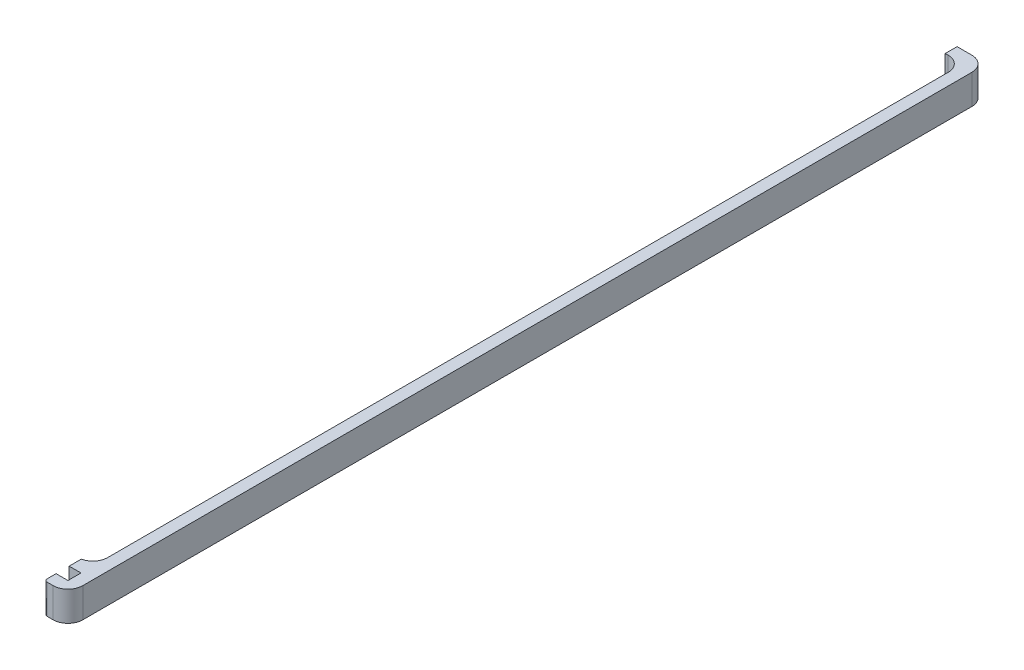
from build123d import *

# Parameters (mm, degrees)
SKETCH1_W                       = 39
SKETCH1_H                       = 155
BOSS_EXTRUDE1_DEPTH             = 2
BOSS_EXTRUDE2_DEPTH             = 38
SKETCH3_W                       = 2
SKETCH3_H                       = 2
BOSS_EXTRUDE3_DEPTH             = 38
SKETCH4_W                       = 2
SKETCH4_H                       = 2
BOSS_EXTRUDE4_DEPTH             = 151
SKETCH6_W                       = 35
SKETCH6_H                       = 2.2
CUT_EXTRUDE1_DEPTH              = 160.340045186
SKETCH7_W                       = 35
SKETCH7_H                       = 2.2
CUT_EXTRUDE2_DEPTH              = 89.490112442
SKETCH5_W                       = 31
SKETCH5_H                       = 2
BOSS_EXTRUDE5_DEPTH             = 2
BOSS_EXTRUDE6_REACH             = 91.367
SKETCH8_W                       = 2
SKETCH8_H                       = 2
BOSS_EXTRUDE6_DIRECTION_2_REACH = 91.367
SKETCH10_W                      = 2
SKETCH10_H                      = 2.2
SKETCH10_W_2                    = 2.2
SKETCH10_H_2                    = 2
BOSS_EXTRUDE8_DEPTH             = 2
SKETCH11_W                      = 2
SKETCH11_H                      = 2.2
SKETCH11_W_2                    = 2.2
SKETCH11_H_2                    = 2
BOSS_EXTRUDE9_DEPTH             = 2
FILLET2_R                       = 2.5
SKETCH14_W                      = 36.5
SKETCH14_H                      = 7.75
BOSS_EXTRUDE10_DEPTH            = 2
SKETCH13_W                      = 31
SKETCH13_H                      = 3
CUT_EXTRUDE4_DEPTH              = 2
FILLET3_R                       = 2
FILLET4_R                       = 0.5
SKETCH15_R                      = 5.1
CUT_EXTRUDE5_DEPTH              = 90.367219941
SKETCH16_R                      = 7.1
BOSS_EXTRUDE11_DEPTH            = 1
FILLET5_R                       = 0.5
CUT_EXTRUDE3_DEPTH              = 160.340045186
FILLET6_R                       = 0.4
FILLET7_R                       = 0.5
CUT_EXTRUDE6_DEPTH              = 6
SKETCH18_W                      = 29
SKETCH18_H                      = 3
CUT_EXTRUDE8_DEPTH              = 90.367220028
CUT_EXTRUDE11_DEPTH             = 90.367220028
CUT_EXTRUDE11_DEPTH_BACK        = 90.367220028
SKETCH20_W                      = 29
SKETCH20_H                      = 34
SKETCH21_W                      = 155
SKETCH21_H                      = 10
CUT_EXTRUDE12_DEPTH             = 90.367219941
SKETCH22_W                      = 155
SKETCH22_H                      = 15
CUT_EXTRUDE13_DEPTH             = 84.254129027


with BuildPart() as part:
    # Sketch1 → Boss-Extrude1 (new body)
    with BuildSketch(Plane(origin=(0, 0, 0), x_dir=(1, 0, 0), z_dir=(0, 1, 0))):
        Rectangle(SKETCH1_W, SKETCH1_H)
    extrude(amount=BOSS_EXTRUDE1_DEPTH)

    # Sketch2 → Boss-Extrude2 (add)
    with BuildSketch(Plane(origin=(0, 2, 0), x_dir=(1, 0, 0), z_dir=(0, 1, 0))):
        Polygon((-17.5, -77.5), (-17.5, -75.5), (-17.5, 75.5), (17.5, 75.5), (17.5, -75.5), (17.5, -77.5), (19.5, -77.5), (19.5, 77.5), (-19.5, 77.5), (-19.5, -77.5), align=None)
    extrude(amount=BOSS_EXTRUDE2_DEPTH)

    # Sketch3 → Boss-Extrude3 (add)
    with BuildSketch(Plane(origin=(0, 2, 0), x_dir=(1, 0, 0), z_dir=(0, 1, 0))):
        with Locations((-16.5, -76.5)):
            Rectangle(SKETCH3_W, SKETCH3_H)
        with Locations((-16.5, -72.3)):
            Rectangle(SKETCH3_W, SKETCH3_H)
        with Locations((16.5, -76.5)):
            Rectangle(SKETCH3_W, SKETCH3_H)
        with Locations((16.5, -72.3)):
            Rectangle(SKETCH3_W, SKETCH3_H)
    extrude(amount=BOSS_EXTRUDE3_DEPTH)

    # Sketch4 → Boss-Extrude4 (add)
    with BuildSketch(Plane.XY.offset(-75.5)):
        with Locations((-16.5, 39)):
            Rectangle(SKETCH4_W, SKETCH4_H)
        Polygon((-15.5, 33.8), (-17.5, 31.8), (-17.5, 35.8), (-15.5, 35.8), align=None)
        Polygon((15.5, 35.8), (17.5, 35.8), (17.5, 31.8), (15.5, 33.8), align=None)
        with Locations((16.5, 39)):
            Rectangle(SKETCH4_W, SKETCH4_H)
    extrude(amount=BOSS_EXTRUDE4_DEPTH)

    # Sketch6 → Cut-Extrude1 (cut, through all)
    with BuildSketch(Plane.XY.offset(-75.5)):
        with Locations((0, 36.9)):
            Rectangle(SKETCH6_W, SKETCH6_H)
    extrude(amount=CUT_EXTRUDE1_DEPTH, mode=Mode.SUBTRACT)

    # Sketch7 → Cut-Extrude2 (cut, through all)
    with BuildSketch(Plane(origin=(0, 2, 0), x_dir=(1, 0, 0), z_dir=(0, 1, 0))):
        with Locations((0, -74.4)):
            Rectangle(SKETCH7_W, SKETCH7_H)
    extrude(amount=CUT_EXTRUDE2_DEPTH, mode=Mode.SUBTRACT)

    # Sketch5 → Boss-Extrude5 (add)
    with BuildSketch(Plane(origin=(0, 2, 0), x_dir=(1, 0, 0), z_dir=(0, 1, 0))):
        with Locations((0, -76.5)):
            Rectangle(SKETCH5_W, SKETCH5_H)
        with Locations((0, -72.3)):
            Rectangle(SKETCH5_W, SKETCH5_H)
    extrude(amount=BOSS_EXTRUDE5_DEPTH)

    # Boss-Extrude6: up to this face of the body (flat: up to its plane)
    boss_extrude6_end = Plane(part.part.faces().sort_by_distance((17.5, 16.9, -2.1))[0])
    # Sketch8 → Boss-Extrude6 (add, up to the picked face)
    with BuildSketch(Plane(origin=(0, 0, 0), x_dir=(0, 0, -1), z_dir=(1, 0, 0)), mode=Mode.PRIVATE) as boss_extrude6_sk1:
        with Locations((74.5, 39)):
            Rectangle(SKETCH8_W, SKETCH8_H)
    boss_extrude6_tool1 = split(extrude(boss_extrude6_sk1.sketch, amount=BOSS_EXTRUDE6_REACH, mode=Mode.PRIVATE), bisect_by=boss_extrude6_end, keep=Keep.BOTH, mode=Mode.PRIVATE)
    # Sketch8 → Boss-Extrude6 (add, up to the picked face)
    with BuildSketch(Plane(origin=(0, 0, 0), x_dir=(0, 0, -1), z_dir=(1, 0, 0)), mode=Mode.PRIVATE) as boss_extrude6_sk2:
        Polygon((75.5, 35.8), (73.5, 35.8), (73.5, 33.8), (75.5, 31.8), align=None)
    boss_extrude6_tool2 = split(extrude(boss_extrude6_sk2.sketch, amount=BOSS_EXTRUDE6_REACH, mode=Mode.PRIVATE), bisect_by=boss_extrude6_end, keep=Keep.BOTH, mode=Mode.PRIVATE)
    add(boss_extrude6_tool1.solids().sort_by(Axis((0, 39, -74.5), (1, 0, 0)))[0])
    add(boss_extrude6_tool2.solids().sort_by(Axis((0, 34.244444, -74.611111), (1, 0, 0)))[0])

    # Boss-Extrude6 direction 2: up to this face of the body (flat: up to its plane)
    boss_extrude6_direction_2_end = Plane(part.part.faces().sort_by_distance((-17.5, 16.9, -2.1))[0])
    # Sketch8 → Boss-Extrude6 direction 2 (add, up to the picked face)
    with BuildSketch(Plane(origin=(0, 0, 0), x_dir=(0, 0, -1), z_dir=(1, 0, 0)), mode=Mode.PRIVATE) as boss_extrude6_direction_2_sk1:
        with Locations((74.5, 39)):
            Rectangle(SKETCH8_W, SKETCH8_H)
    boss_extrude6_direction_2_tool1 = split(extrude(boss_extrude6_direction_2_sk1.sketch, amount=-BOSS_EXTRUDE6_DIRECTION_2_REACH, mode=Mode.PRIVATE), bisect_by=boss_extrude6_direction_2_end, keep=Keep.BOTH, mode=Mode.PRIVATE)
    # Sketch8 → Boss-Extrude6 direction 2 (add, up to the picked face)
    with BuildSketch(Plane(origin=(0, 0, 0), x_dir=(0, 0, -1), z_dir=(1, 0, 0)), mode=Mode.PRIVATE) as boss_extrude6_direction_2_sk2:
        Polygon((75.5, 35.8), (73.5, 35.8), (73.5, 33.8), (75.5, 31.8), align=None)
    boss_extrude6_direction_2_tool2 = split(extrude(boss_extrude6_direction_2_sk2.sketch, amount=-BOSS_EXTRUDE6_DIRECTION_2_REACH, mode=Mode.PRIVATE), bisect_by=boss_extrude6_direction_2_end, keep=Keep.BOTH, mode=Mode.PRIVATE)
    add(boss_extrude6_direction_2_tool1.solids().sort_by(Axis((0, 39, -74.5), (-1, 0, 0)))[0])
    add(boss_extrude6_direction_2_tool2.solids().sort_by(Axis((0, 34.244444, -74.611111), (-1, 0, 0)))[0])

    # Sketch10 → Boss-Extrude8 (add)
    with BuildSketch(Plane(origin=(-17.5, 0, 0), x_dir=(0, 0, -1), z_dir=(1, 0, 0))):
        with Locations((-76.5, 36.9)):
            Rectangle(SKETCH10_W, SKETCH10_H)
        with Locations((-74.4, 39)):
            Rectangle(SKETCH10_W_2, SKETCH10_H_2)
    extrude(amount=BOSS_EXTRUDE8_DEPTH)

    # Sketch11 → Boss-Extrude9 (add)
    with BuildSketch(Plane.ZY.offset(-17.5)):
        with Locations((76.5, 36.9)):
            Rectangle(SKETCH11_W, SKETCH11_H)
        with Locations((74.4, 39)):
            Rectangle(SKETCH11_W_2, SKETCH11_H_2)
    extrude(amount=BOSS_EXTRUDE9_DEPTH)

    # Fillet2
    fillet2_edges = [part.edges().sort_by_distance(p)[0] for p in [
        (-17.5, 16.9, 71.3),
        (17.5, 16.9, 71.3),
        (19.5, 20, 77.5),
        (-19.5, 20, 77.5),
        (-19.5, 20, -77.5),
        (-17.5, 16.9, -75.5),
        (17.5, 16.9, -75.5),
        (19.5, 20, -77.5),
        (19.5, 40, 0),
        (-19.5, 40, 0),
        (19.5, 0, 0),
        (-19.5, 0, 0),
        (0, 40, -77.5),
        (0, 0, 77.5),
        (0, 0, -77.5),
        (-17.5, 40, 77.5),
        (17.5, 40, 77.5),
    ]]
    fillet(fillet2_edges, radius=FILLET2_R)

    # Sketch14 → Boss-Extrude10 (add)
    with BuildSketch(Plane.XY.offset(-75.5)):
        with Locations((0, 5.125)):
            Rectangle(SKETCH14_W, SKETCH14_H)
    extrude(amount=BOSS_EXTRUDE10_DEPTH)

    # Sketch13 → Cut-Extrude4 (cut)
    with BuildSketch(Plane(origin=(0, 0, -77.5), x_dir=(-1, 0, 0), z_dir=(0, 0, -1))):
        with Locations((0, 5.5)):
            Rectangle(SKETCH13_W, SKETCH13_H)
    extrude(amount=-CUT_EXTRUDE4_DEPTH, mode=Mode.SUBTRACT)

    # Fillet3
    fillet3_edges = [part.edges().sort_by_distance(p)[0] for p in [
        (0, 9, -73.5),
    ]]
    fillet(fillet3_edges, radius=FILLET3_R - 0.0001)  # a hair under: the kernel refuses the full size

    # Fillet4
    fillet4_edges = [part.edges().sort_by_distance(p)[0] for p in [
        (15.5, 5.5, -75.5),
        (15.5, 4, -76.5),
        (0, 7, -75.5),
        (15.5, 7, -76.5),
        (-15.5, 5.5, -75.5),
        (-15.5, 7, -76.5),
        (0, 4, -75.5),
        (-15.5, 4, -76.5),
        (15.5, 5.5, -77.5),
        (0, 4, -77.5),
        (-15.5, 5.5, -77.5),
        (0, 7, -77.5),
    ]]
    fillet(fillet4_edges, radius=FILLET4_R)

    # Sketch15 → Cut-Extrude5 (cut, through all)
    with BuildSketch(Plane.XZ):
        with Locations(Location((0, 38.75, 0), (0, 0, 270))):
            Circle(SKETCH15_R)
        with Locations(Location((0, -38.75, 0), (0, 0, 270))):
            Circle(SKETCH15_R)
    extrude(amount=-CUT_EXTRUDE5_DEPTH, mode=Mode.SUBTRACT)

    # Sketch16 → Boss-Extrude11 (add)
    with BuildSketch(Plane(origin=(0, 2, 0), x_dir=(1, 0, 0), z_dir=(0, 1, 0))):
        with Locations(Location((0, 38.75, 0), (0, 0, 270))):
            Circle(SKETCH16_R)
        with Locations(Location((0, -38.75, 0), (0, 0, 270))):
            Circle(SKETCH16_R)
    extrude(amount=BOSS_EXTRUDE11_DEPTH)

    # Fillet5
    fillet5_edges = [part.edges().sort_by_distance(p)[0] for p in [
        (0, 2, -45.85),
        (0, 3, -45.85),
        (0, 2, 31.65),
        (0, 3, 31.65),
    ]]
    fillet(fillet5_edges, radius=FILLET5_R - 0.0001)  # a hair under: the kernel refuses the full size

    # Sketch12 → Cut-Extrude3 (cut, through all)
    with BuildSketch(Plane.XY.offset(-75.5)):
        with BuildLine():
            Line((1.668907005, 12.688040659), (2.22520934, 10.250720878))
            ThreePointArc((2.22520934, 10.250720878), (4.338837391, 10.990311321), (6.234898019, 12.181685175))
            Line((6.234898019, 12.181685175), (4.676173514, 14.136263881))
            ThreePointArc((4.676173514, 14.136263881), (3.254128043, 13.242733491), (1.668907005, 12.688040659))
        make_face()
        with BuildLine():
            ThreePointArc((-6.234898019, 12.181685175), (-4.338837391, 10.990311321), (-2.22520934, 10.250720878))
            Line((-2.22520934, 10.250720878), (-1.668907005, 12.688040659))
            ThreePointArc((-1.668907005, 12.688040659), (-3.254128043, 13.242733491), (-4.676173514, 14.136263881))
            Line((-4.676173514, 14.136263881), (-6.234898019, 12.181685175))
        make_face()
        with BuildLine():
            ThreePointArc((-10, 20), (-9.749279122, 17.77479066), (-9.009688679, 15.661162609))
            Line((-9.009688679, 15.661162609), (-6.757266509, 16.745871957))
            ThreePointArc((-6.757266509, 16.745871957), (-7.311959341, 18.331092995), (-7.5, 20))
            Line((-7.5, 20), (-10, 20))
        make_face()
        with BuildLine():
            ThreePointArc((-6.234898019, 27.818314825), (-7.818314825, 26.234898019), (-9.009688679, 24.338837391))
            Line((-9.009688679, 24.338837391), (-6.757266509, 23.254128043))
            ThreePointArc((-6.757266509, 23.254128043), (-5.863736119, 24.676173514), (-4.676173514, 25.863736119))
            Line((-4.676173514, 25.863736119), (-6.234898019, 27.818314825))
        make_face()
        with BuildLine():
            ThreePointArc((-1.668907005, 27.311959341), (-0.839733571, 27.452841574), (0, 27.5))
            Line((0, 27.5), (0, 30))
            ThreePointArc((0, 30), (-1.119644761, 29.937122099), (-2.22520934, 29.749279122))
            Line((-2.22520934, 29.749279122), (-1.668907005, 27.311959341))
        make_face()
        with BuildLine():
            Line((0, 30), (0, 27.5))
            ThreePointArc((0, 27.5), (0.839733571, 27.452841574), (1.668907005, 27.311959341))
            Line((1.668907005, 27.311959341), (2.22520934, 29.749279122))
            ThreePointArc((2.22520934, 29.749279122), (1.119644761, 29.937122099), (0, 30))
        make_face()
        with BuildLine():
            Line((6.757266509, 23.254128043), (9.009688679, 24.338837391))
            ThreePointArc((9.009688679, 24.338837391), (7.818314825, 26.234898019), (6.234898019, 27.818314825))
            Line((6.234898019, 27.818314825), (4.676173514, 25.863736119))
            ThreePointArc((4.676173514, 25.863736119), (5.863736119, 24.676173514), (6.757266509, 23.254128043))
        make_face()
        with BuildLine():
            Line((6.757266509, 16.745871957), (9.009688679, 15.661162609))
            ThreePointArc((9.009688679, 15.661162609), (9.749279122, 17.77479066), (10, 20))
            Line((10, 20), (7.5, 20))
            ThreePointArc((7.5, 20), (7.311959341, 18.331092995), (6.757266509, 16.745871957))
        make_face()
        with BuildLine():
            ThreePointArc((2.5, 20), (2.43731978, 19.443697665), (2.25242217, 18.915290652))
            Line((2.25242217, 18.915290652), (4.50484434, 17.830581304))
            ThreePointArc((4.50484434, 17.830581304), (4.874639561, 18.88739533), (5, 20))
            Line((5, 20), (2.5, 20))
        make_face()
        with BuildLine():
            ThreePointArc((1.558724505, 21.954578706), (1.954578706, 21.558724505), (2.25242217, 21.084709348))
            Line((2.25242217, 21.084709348), (4.50484434, 22.169418696))
            ThreePointArc((4.50484434, 22.169418696), (3.909157412, 23.117449009), (3.117449009, 23.909157412))
            Line((3.117449009, 23.909157412), (1.558724505, 21.954578706))
        make_face()
        with BuildLine():
            Line((0, 25), (0, 22.5))
            ThreePointArc((0, 22.5), (0.27991119, 22.484280525), (0.556302335, 22.43731978))
            Line((0.556302335, 22.43731978), (1.11260467, 24.874639561))
            ThreePointArc((1.11260467, 24.874639561), (0.559822381, 24.968561049), (0, 25))
        make_face()
        with BuildLine():
            ThreePointArc((-0.556302335, 22.43731978), (-0.27991119, 22.484280525), (0, 22.5))
            Line((0, 22.5), (0, 25))
            ThreePointArc((0, 25), (-0.559822381, 24.968561049), (-1.11260467, 24.874639561))
            Line((-1.11260467, 24.874639561), (-0.556302335, 22.43731978))
        make_face()
        with BuildLine():
            ThreePointArc((-2.25242217, 21.084709348), (-1.954578706, 21.558724505), (-1.558724505, 21.954578706))
            Line((-1.558724505, 21.954578706), (-3.117449009, 23.909157412))
            ThreePointArc((-3.117449009, 23.909157412), (-3.909157412, 23.117449009), (-4.50484434, 22.169418696))
            Line((-4.50484434, 22.169418696), (-2.25242217, 21.084709348))
        make_face()
        with BuildLine():
            ThreePointArc((-2.25242217, 18.915290652), (-2.43731978, 19.443697665), (-2.5, 20))
            Line((-2.5, 20), (-5, 20))
            ThreePointArc((-5, 20), (-4.874639561, 18.88739533), (-4.50484434, 17.830581304))
            Line((-4.50484434, 17.830581304), (-2.25242217, 18.915290652))
        make_face()
        with BuildLine():
            ThreePointArc((-3.117449009, 16.090842588), (-2.169418696, 15.49515566), (-1.11260467, 15.125360439))
            Line((-1.11260467, 15.125360439), (-0.556302335, 17.56268022))
            ThreePointArc((-0.556302335, 17.56268022), (-1.084709348, 17.74757783), (-1.558724505, 18.045421294))
            Line((-1.558724505, 18.045421294), (-3.117449009, 16.090842588))
        make_face()
        with BuildLine():
            Line((0.556302335, 17.56268022), (1.11260467, 15.125360439))
            ThreePointArc((1.11260467, 15.125360439), (2.169418696, 15.49515566), (3.117449009, 16.090842588))
            Line((3.117449009, 16.090842588), (1.558724505, 18.045421294))
            ThreePointArc((1.558724505, 18.045421294), (1.084709348, 17.74757783), (0.556302335, 17.56268022))
        make_face()
    extrude(amount=-CUT_EXTRUDE3_DEPTH, mode=Mode.SUBTRACT)

    # Fillet6
    fillet6_edges = [part.edges().sort_by_distance(p)[0] for p in [
        (5.863736119, 24.676173514, -75.5),
        (5.455535766, 26.841025472, -75.5),
        (7.818314825, 26.234898019, -77.5),
        (7.883477594, 23.796482717, -77.5),
        (5.863736119, 24.676173514, -77.5),
        (5.455535766, 26.841025472, -77.5),
        (7.883477594, 23.796482717, -75.5),
        (7.818314825, 26.234898019, -75.5),
        (7.311959341, 18.331092995, -75.5),
        (8.75, 20, -75.5),
        (9.749279122, 17.77479066, -77.5),
        (7.883477594, 16.203517283, -77.5),
        (7.311959341, 18.331092995, -77.5),
        (8.75, 20, -77.5),
        (7.883477594, 16.203517283, -75.5),
        (9.749279122, 17.77479066, -75.5),
        (2.43731978, 19.443697665, -75.5),
        (3.75, 20, -75.5),
        (4.874639561, 18.88739533, -77.5),
        (3.378633255, 18.372935978, -77.5),
        (2.43731978, 19.443697665, -77.5),
        (3.75, 20, -77.5),
        (3.378633255, 18.372935978, -75.5),
        (4.874639561, 18.88739533, -75.5),
        (1.954578706, 21.558724505, -75.5),
        (2.338086757, 22.931868059, -75.5),
        (3.909157412, 23.117449009, -77.5),
        (3.378633255, 21.627064022, -77.5),
        (1.954578706, 21.558724505, -77.5),
        (2.338086757, 22.931868059, -77.5),
        (3.378633255, 21.627064022, -75.5),
        (3.909157412, 23.117449009, -75.5),
        (0, 27.5, -75.5),
        (-1.947058172, 28.530619232, -75.5),
        (0, 30, -77.5),
        (1.947058172, 28.530619232, -77.5),
        (0, 27.5, -77.5),
        (-1.947058172, 28.530619232, -77.5),
        (1.947058172, 28.530619232, -75.5),
        (0, 30, -75.5),
        (-5.863736119, 24.676173514, -75.5),
        (-7.883477594, 23.796482717, -75.5),
        (-7.818314825, 26.234898019, -77.5),
        (-5.455535766, 26.841025472, -77.5),
        (-5.863736119, 24.676173514, -77.5),
        (-7.883477594, 23.796482717, -77.5),
        (-5.455535766, 26.841025472, -75.5),
        (-7.818314825, 26.234898019, -75.5),
        (-7.311959341, 18.331092995, -75.5),
        (-7.883477594, 16.203517283, -75.5),
        (-9.749279122, 17.77479066, -77.5),
        (-8.75, 20, -77.5),
        (-7.311959341, 18.331092995, -77.5),
        (-7.883477594, 16.203517283, -77.5),
        (-8.75, 20, -75.5),
        (-9.749279122, 17.77479066, -75.5),
        (-3.254128043, 13.242733491, -75.5),
        (-1.947058172, 11.469380768, -75.5),
        (-4.338837391, 10.990311321, -77.5),
        (-5.455535766, 13.158974528, -77.5),
        (-3.254128043, 13.242733491, -77.5),
        (-1.947058172, 11.469380768, -77.5),
        (-5.455535766, 13.158974528, -75.5),
        (-4.338837391, 10.990311321, -75.5),
        (1.084709348, 17.74757783, -75.5),
        (2.338086757, 17.068131941, -75.5),
        (2.169418696, 15.49515566, -77.5),
        (0.834453502, 16.344020329, -77.5),
        (1.084709348, 17.74757783, -77.5),
        (2.338086757, 17.068131941, -77.5),
        (0.834453502, 16.344020329, -75.5),
        (2.169418696, 15.49515566, -75.5),
        (-2.43731978, 19.443697665, -75.5),
        (-3.378633255, 18.372935978, -75.5),
        (-4.874639561, 18.88739533, -77.5),
        (-3.75, 20, -77.5),
        (-2.43731978, 19.443697665, -77.5),
        (-3.378633255, 18.372935978, -77.5),
        (-3.75, 20, -75.5),
        (-4.874639561, 18.88739533, -75.5),
        (-1.084709348, 17.74757783, -75.5),
        (-0.834453502, 16.344020329, -75.5),
        (-2.169418696, 15.49515566, -77.5),
        (-2.338086757, 17.068131941, -77.5),
        (-1.084709348, 17.74757783, -77.5),
        (-0.834453502, 16.344020329, -77.5),
        (-2.338086757, 17.068131941, -75.5),
        (-2.169418696, 15.49515566, -75.5),
        (-1.954578706, 21.558724505, -75.5),
        (-3.378633255, 21.627064022, -75.5),
        (-3.909157412, 23.117449009, -77.5),
        (-2.338086757, 22.931868059, -77.5),
        (-1.954578706, 21.558724505, -77.5),
        (-3.378633255, 21.627064022, -77.5),
        (-2.338086757, 22.931868059, -75.5),
        (-3.909157412, 23.117449009, -75.5),
        (0, 25, -77.5),
        (0.834453502, 23.655979671, -77.5),
        (0, 22.5, -75.5),
        (-0.834453502, 23.655979671, -75.5),
        (0, 22.5, -77.5),
        (-0.834453502, 23.655979671, -77.5),
        (0, 25, -75.5),
        (0.834453502, 23.655979671, -75.5),
        (3.254128043, 13.242733491, -75.5),
        (5.455535766, 13.158974528, -75.5),
        (4.338837391, 10.990311321, -77.5),
        (1.947058172, 11.469380768, -77.5),
        (3.254128043, 13.242733491, -77.5),
        (5.455535766, 13.158974528, -77.5),
        (1.947058172, 11.469380768, -75.5),
        (4.338837391, 10.990311321, -75.5),
    ]]
    fillet(fillet6_edges, radius=FILLET6_R)

    # Fillet7
    fillet7_edges = [part.edges().sort_by_distance(p)[0] for p in [
        (15.5, 40, 0.75),
        (0, 4, 77.5),
        (0, 40, -73.5),
        (-15.5, 40, 0.75),
        (-15.5, 20.75, 77.5),
        (-15.5, 39.267766953, 76.767766953),
        (15.5, 20.75, 77.5),
        (15.5, 39.267766953, 76.767766953),
    ]]
    fillet(fillet7_edges, radius=FILLET7_R)

    # Sketch17 → Cut-Extrude6 (cut)
    with BuildSketch(Plane.XZ):
        Polygon((-17, -77.5), (-17, 70.299999999), (-14.999999999, 71.3), (-14.999999999, 77.5), (14.999999999, 77.5), (14.999999999, 71.3), (17, 70.299999999), (17, -77.5), align=None)
    extrude(amount=-CUT_EXTRUDE6_DEPTH, mode=Mode.SUBTRACT)

    # Sketch18 → Cut-Extrude8 (cut, through all)
    with BuildSketch(Plane.XY):
        with Locations((0, 7.5)):
            Rectangle(SKETCH18_W, SKETCH18_H)
    extrude(amount=-CUT_EXTRUDE8_DEPTH, mode=Mode.SUBTRACT)

    # Sketch20 → Cut-Extrude11 (cut, two sides: drawn at the far end of the back side and taken through both)
    with BuildSketch(Plane.XY.offset(-CUT_EXTRUDE11_DEPTH_BACK)):
        with Locations((0, 23)):
            Rectangle(SKETCH20_W, SKETCH20_H)
    extrude(amount=CUT_EXTRUDE11_DEPTH + CUT_EXTRUDE11_DEPTH_BACK, mode=Mode.SUBTRACT)


with BuildPart() as body_2:
    # of the pieces the cut leaves, the one that is kept (cut_extrude11_keep)
    add(part.part.solids().sort_by_distance((14.5, 40, -75))[0])

    # Sketch21 → Cut-Extrude12 (cut, through all)
    with BuildSketch(Plane(origin=(0, 0, 0), x_dir=(0, 0, -1), z_dir=(1, 0, 0))):
        with Locations((0, 35)):
            Rectangle(SKETCH21_W, SKETCH21_H)
        with Locations((0, 5)):
            Rectangle(SKETCH21_W, SKETCH21_H)
    extrude(amount=CUT_EXTRUDE12_DEPTH, mode=Mode.SUBTRACT)

    # Sketch22 → Cut-Extrude13 (cut, through all)
    with BuildSketch(Plane(origin=(19.5, 0, 0), x_dir=(0, 0, -1), z_dir=(1, 0, 0))):
        with Locations((0, 17.5)):
            Rectangle(SKETCH22_W, SKETCH22_H)
    extrude(amount=-CUT_EXTRUDE13_DEPTH, mode=Mode.SUBTRACT)


solid = body_2.part
